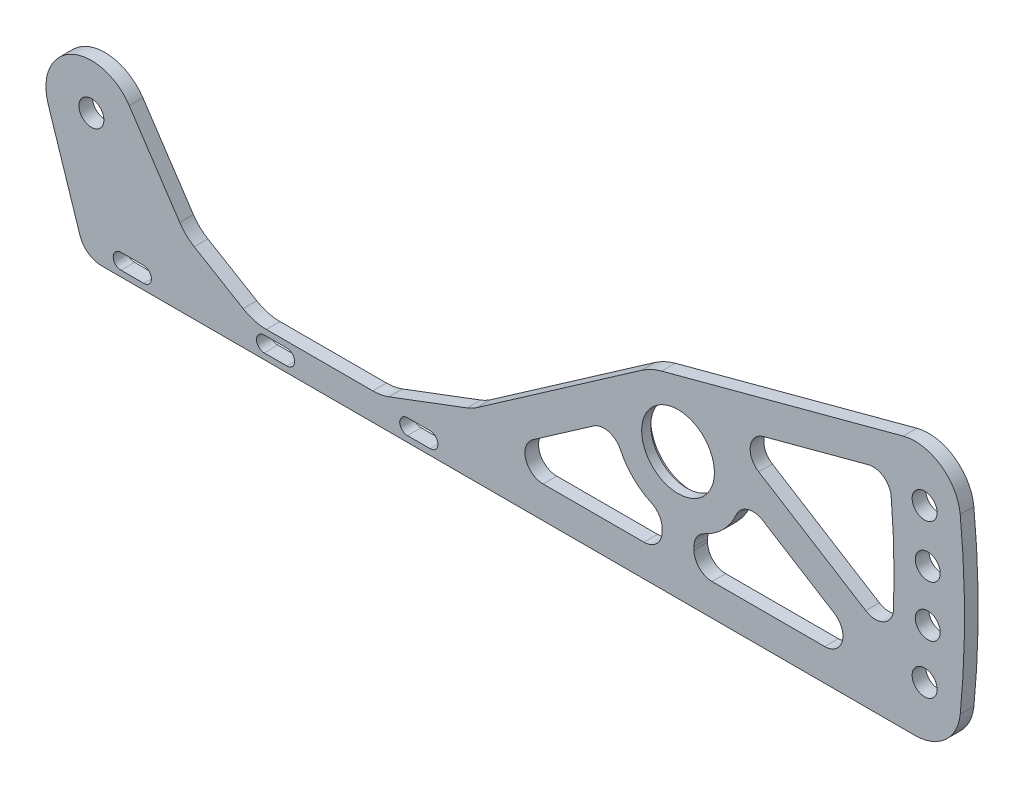
from build123d import *

# Parameters (mm, degrees)
SKETCH_1_R          = 8
EXTRUDE_1_DEPTH     = 3
HOLE_WIZARD_M31_D   = 3.4
HOLE_WIZARD_M51_D   = 5.5
HOLE_WIZARD_M52_D   = 5.5
FILLET_1_R          = 10
FILLET_2_R          = 5
CUT_EXTRUDE_1_DEPTH = 195.061830596
FILLET_3_R          = 4
SKETCH_9_R          = 9
CUT_EXTRUDE_2_DEPTH = 1
CUT_EXTRUDE_3_DEPTH = 195.061830596


with BuildPart() as part:
    # Эскиз1 → Бобышка-Вытянуть1 (new body)
    with BuildSketch(Plane.XY):
        with BuildLine():
            Line((-9.508526364, -3.096437692), (-1.398717752, -28))
            Line((-1.398717752, -28), (189.947361129, -28))
            ThreePointArc((189.947361129, -28), (191.995297124, 1.34383112), (189.536809823, 30.656120467))
            Line((189.536809823, 30.656120467), (125.388049295, 13.526041997))
            ThreePointArc((125.388049295, 13.526041997), (123.105499175, 12.698616461), (121.000225207, 11.489282104))
            Line((121.000225207, 11.489282104), (83.76563687, -14.436473614))
            Line((83.76563687, -14.436473614), (63.718090084, -22))
            Line((63.718090084, -22), (35.731449132, -22))
            Line((35.731449132, -22), (20.675178874, -13.02912429))
            Line((20.675178874, -13.02912429), (8.326583423, 5.537870395))
            ThreePointArc((8.326583423, 5.537870395), (-4.357415095, 9.00071851), (-9.508526364, -3.096437692))
        make_face()
        with Locations((129, 0)):
            Circle(SKETCH_1_R, mode=Mode.SUBTRACT)
    extrude(amount=EXTRUDE_1_DEPTH)

    # Отверстие с зазором M31 (through all)
    with Locations(Plane.XY.offset(3)):
        with Locations((9, -25), (40.5, -25), (72, -25)):
            Hole(HOLE_WIZARD_M31_D / 2)

    # Отверстие с зазором M51 (through all)
    with Locations(Plane.XY.offset(3)):
        with Locations((0, 0)):
            Hole(HOLE_WIZARD_M51_D / 2)

    # Отверстие с зазором M52 (through all)
    with Locations(Plane.XY.offset(3)):
        with Locations((183.228106674, 16.836297834), (183.914180714, 5.619086431), (183.914180714, -5.619086431), (183.228106674, -16.836297834)):
            Hole(HOLE_WIZARD_M52_D / 2)

    # Скругление1
    fillet_1_edges = [part.edges().sort_by_distance(p)[0] for p in [
        (35.731449132, -22, 1.5),
        (20.675178874, -13.02912429, 1.5),
        (63.718090084, -22, 1.5),
        (83.76563687, -14.436473614, 1.5),
        (189.947361129, -28, 1.5),
        (189.536809823, 30.656120467, 1.5),
    ]]
    fillet(fillet_1_edges, radius=FILLET_1_R)

    # Скругление2
    fillet_2_edges = [part.edges().sort_by_distance(p)[0] for p in [
        (-1.398717752, -28, 1.5),
    ]]
    fillet(fillet_2_edges, radius=FILLET_2_R)

    # Эскиз8 → Вырез-Вытянуть1 (cut, through all)
    with BuildSketch(Plane.XY.offset(3)):
        with BuildLine():
            Line((138.90792063, 9.891062066), (175.404223108, 19.636917172))
            ThreePointArc((175.404223108, 19.636917172), (176.470620047, 3.220288824), (176.003884761, -13.22431658))
            Line((176.003884761, -13.22431658), (138.90792063, 9.891062066))
        make_face()
        with BuildLine():
            Line((142.971746687, -0.888985098), (175.246255309, -21))
            Line((175.246255309, -21), (132.5, -21))
            Line((132.5, -21), (132.5, -13.555441712))
            ThreePointArc((132.5, -13.555441712), (139.790053932, -8.92046726), (142.971746687, -0.888985098))
        make_face()
        with BuildLine():
            Line((115.05010243, -1.183367143), (86.589440581, -21))
            Line((86.589440581, -21), (125.5, -21))
            Line((125.5, -21), (125.5, -13.555441712))
            ThreePointArc((125.5, -13.555441712), (118.304590303, -9.033726331), (115.05010243, -1.183367143))
        make_face()
    extrude(amount=-CUT_EXTRUDE_1_DEPTH, mode=Mode.SUBTRACT)

    # Скругление3
    fillet_3_edges = [part.edges().sort_by_distance(p)[0] for p in [
        (86.589440581, -21, 1.5),
        (125.5, -21, 1.5),
        (115.05010243, -1.183367143, 1.5),
        (125.5, -13.555441712, 1.5),
        (132.5, -21, 1.5),
        (132.5, -13.555441712, 1.5),
        (142.971746687, -0.888985098, 1.5),
        (175.246255309, -21, 1.5),
        (176.003884761, -13.22431658, 1.5),
        (175.404223108, 19.636917172, 1.5),
        (138.90792063, 9.891062066, 1.5),
    ]]
    fillet(fillet_3_edges, radius=FILLET_3_R)

    # Эскиз9 → Вырез-Вытянуть2 (cut)
    with BuildSketch(Plane(origin=(0, 0, 0), x_dir=(-1, 0, 0), z_dir=(0, 0, -1))):
        with Locations((-129, 0)):
            Circle(SKETCH_9_R)
    extrude(amount=-CUT_EXTRUDE_2_DEPTH, mode=Mode.SUBTRACT)

    # Эскиз10 → Вырез-Вытянуть3 (cut, through all)
    with BuildSketch(Plane.XY.offset(3)):
        with BuildLine():
            Line((6.5, -23.3), (11.5, -23.3))
            ThreePointArc((11.5, -23.3), (13.2, -25), (11.5, -26.7))
            Line((11.5, -26.7), (6.5, -26.7))
            ThreePointArc((6.5, -26.7), (4.8, -25), (6.5, -23.3))
        make_face()
        with BuildLine():
            Line((38, -23.3), (43, -23.3))
            ThreePointArc((43, -23.3), (44.7, -25), (43, -26.7))
            Line((43, -26.7), (38, -26.7))
            ThreePointArc((38, -26.7), (36.3, -25), (38, -23.3))
        make_face()
        with BuildLine():
            Line((69.5, -23.3), (74.5, -23.3))
            ThreePointArc((74.5, -23.3), (76.2, -25), (74.5, -26.7))
            Line((74.5, -26.7), (69.5, -26.7))
            ThreePointArc((69.5, -26.7), (67.8, -25), (69.5, -23.3))
        make_face()
    extrude(amount=-CUT_EXTRUDE_3_DEPTH, mode=Mode.SUBTRACT)


solid = part.part
